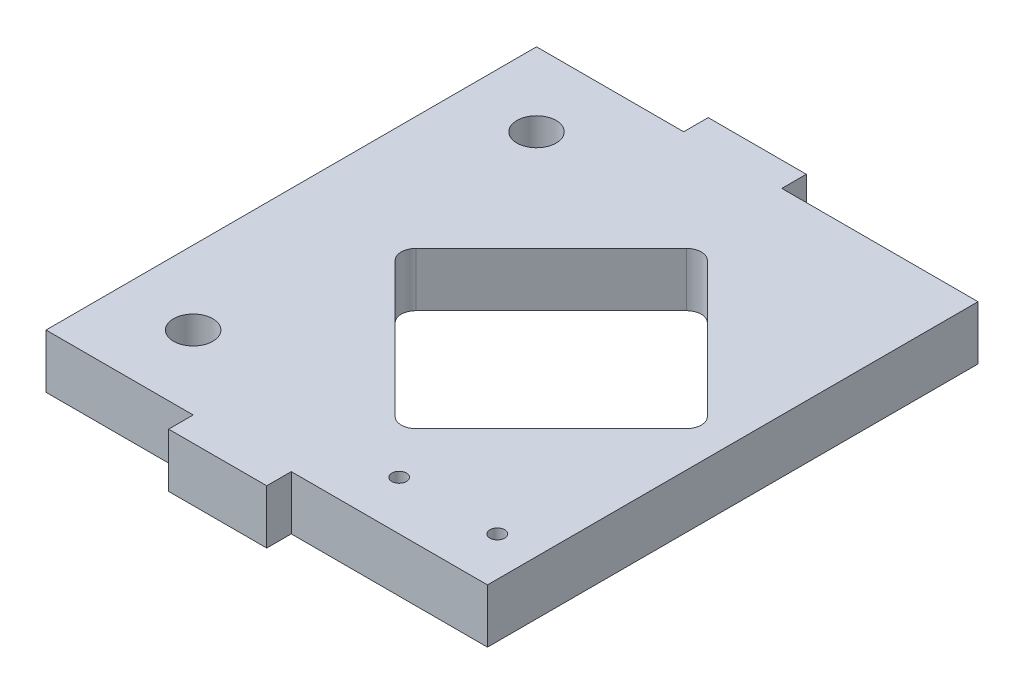
from build123d import *

# Parameters (mm, degrees)
SKETCH1_R           = 4
BOSS_EXTRUDE1_DEPTH = 11
SKETCH2_R           = 1.5
CUT_EXTRUDE1_DEPTH  = 10
CUT_EXTRUDE2_DEPTH  = 11
FILLET1_R           = 3


with BuildPart() as part:
    # Sketch1 → Boss-Extrude1 (new body)
    with BuildSketch(Plane(origin=(0, 0, 0), x_dir=(1, 0, 0), z_dir=(0, 1, 0))):
        Polygon((0, 50), (40, 50), (40, -50), (0, -50), (0, -55), (-20, -55), (-20, -50), (-40, -50), (-50, -50), (-50, 50), (-40, 50), (-20, 50), (-20, 55), (0, 55), align=None)
        with Locations((-35, 35)):
            Circle(SKETCH1_R, mode=Mode.SUBTRACT)
        with Locations((-35, -35)):
            Circle(SKETCH1_R, mode=Mode.SUBTRACT)
    extrude(amount=BOSS_EXTRUDE1_DEPTH)

    # Sketch2 → Cut-Extrude1 (cut)
    with BuildSketch(Plane(origin=(0, 11, 0), x_dir=(1, 0, 0), z_dir=(0, 1, 0))):
        with Locations((32, -40)):
            Circle(SKETCH2_R)
        with Locations((12, -40)):
            Circle(SKETCH2_R)
    extrude(amount=-CUT_EXTRUDE1_DEPTH, mode=Mode.SUBTRACT)

    # Sketch3 → Cut-Extrude2 (cut)
    with BuildSketch(Plane(origin=(0, 11, 0), x_dir=(1, 0, 0), z_dir=(0, 1, 0))):
        Polygon((-28.819805153, 0), (3, -31.819805153), (34.819805153, 0), (3, 31.819805153), align=None)
    extrude(amount=-CUT_EXTRUDE2_DEPTH, mode=Mode.SUBTRACT)

    # Fillet1
    fillet1_edges = [part.edges().sort_by_distance(p)[0] for p in [
        (3, 5.5, -31.819805153),
        (-28.819805153, 5.5, 0),
        (3, 5.5, 31.819805153),
        (34.819805153, 5.5, 0),
    ]]
    fillet(fillet1_edges, radius=FILLET1_R)


solid = part.part
